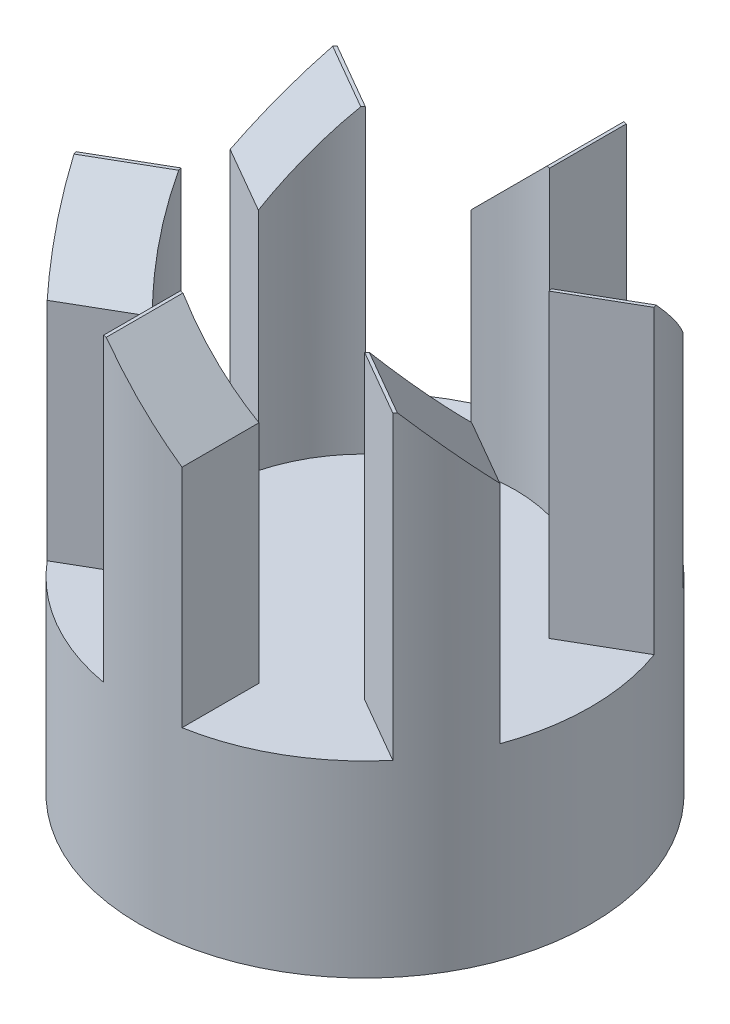
from build123d import *

# Parameters (mm, degrees)
SKETCH1_R           = 6
BOSS_EXTRUDE1_DEPTH = 5
BOSS_EXTRUDE3_DEPTH = 8
CHAMFER2_SIZE       = 2


with BuildPart() as part:
    # Sketch1 → Boss-Extrude1 (new body)
    with BuildSketch(Plane(origin=(0, 0, 0), x_dir=(1, 0, 0), z_dir=(0, 1, 0))):
        Circle(SKETCH1_R)
    extrude(amount=BOSS_EXTRUDE1_DEPTH)

    # Sketch5 → Boss-Extrude3 (add)
    with BuildSketch(Plane(origin=(0, 5, 0), x_dir=(1, 0, 0), z_dir=(0, 1, 0))):
        with BuildLine():
            ThreePointArc((5.638155725, 2.05212086), (5.196152423, 3), (4.596266659, 3.856725658))
            Line((4.596266659, 3.856725658), (2.823580901, 2.833265059))
            ThreePointArc((2.823580901, 2.833265059), (3.464101615, 2), (3.865469967, 1.028660261))
            Line((3.865469967, 1.028660261), (5.638155725, 2.05212086))
        make_face()
        with BuildLine():
            Line((1.041889066, 3.86192532), (1.041889066, 5.908846518))
            ThreePointArc((1.041889066, 5.908846518), (0, 6), (-1.041889066, 5.908846518))
            Line((-1.041889066, 5.908846518), (-1.041889066, 3.86192532))
            ThreePointArc((-1.041889066, 3.86192532), (0, 4), (1.041889066, 3.86192532))
        make_face()
        with BuildLine():
            ThreePointArc((4.596266659, -3.856725658), (5.196152423, -3), (5.638155725, -2.05212086))
            Line((5.638155725, -2.05212086), (3.865469967, -1.028660261))
            ThreePointArc((3.865469967, -1.028660261), (3.464101615, -2), (2.823580901, -2.833265059))
            Line((2.823580901, -2.833265059), (4.596266659, -3.856725658))
        make_face()
        with BuildLine():
            Line((-2.823580901, 2.833265059), (-4.596266659, 3.856725658))
            ThreePointArc((-4.596266659, 3.856725658), (-5.196152423, 3), (-5.638155725, 2.05212086))
            Line((-5.638155725, 2.05212086), (-3.865469967, 1.028660261))
            ThreePointArc((-3.865469967, 1.028660261), (-3.464101615, 2), (-2.823580901, 2.833265059))
        make_face()
        with BuildLine():
            ThreePointArc((-1.041889066, -5.908846518), (0, -6), (1.041889066, -5.908846518))
            Line((1.041889066, -5.908846518), (1.041889066, -3.86192532))
            ThreePointArc((1.041889066, -3.86192532), (0, -4), (-1.041889066, -3.86192532))
            Line((-1.041889066, -3.86192532), (-1.041889066, -5.908846518))
        make_face()
        with BuildLine():
            Line((-3.865469967, -1.028660261), (-5.638155725, -2.05212086))
            ThreePointArc((-5.638155725, -2.05212086), (-5.196152423, -3), (-4.596266659, -3.856725658))
            Line((-4.596266659, -3.856725658), (-2.823580901, -2.833265059))
            ThreePointArc((-2.823580901, -2.833265059), (-3.464101615, -2), (-3.865469967, -1.028660261))
        make_face()
    extrude(amount=BOSS_EXTRUDE3_DEPTH)

    # Chamfer2
    chamfer2_edges = [part.edges().sort_by_distance(p)[0] for p in [
        (1.041889066, 13, 4.885385919),
        (-3.70992378, 13, 3.344995359),
        (-4.751812846, 13, -1.54039056),
        (-1.041889066, 13, -4.885385919),
        (3.70992378, 13, -3.344995359),
        (4.751812846, 13, 1.54039056),
    ]]
    chamfer(chamfer2_edges, length=CHAMFER2_SIZE)


solid = part.part
